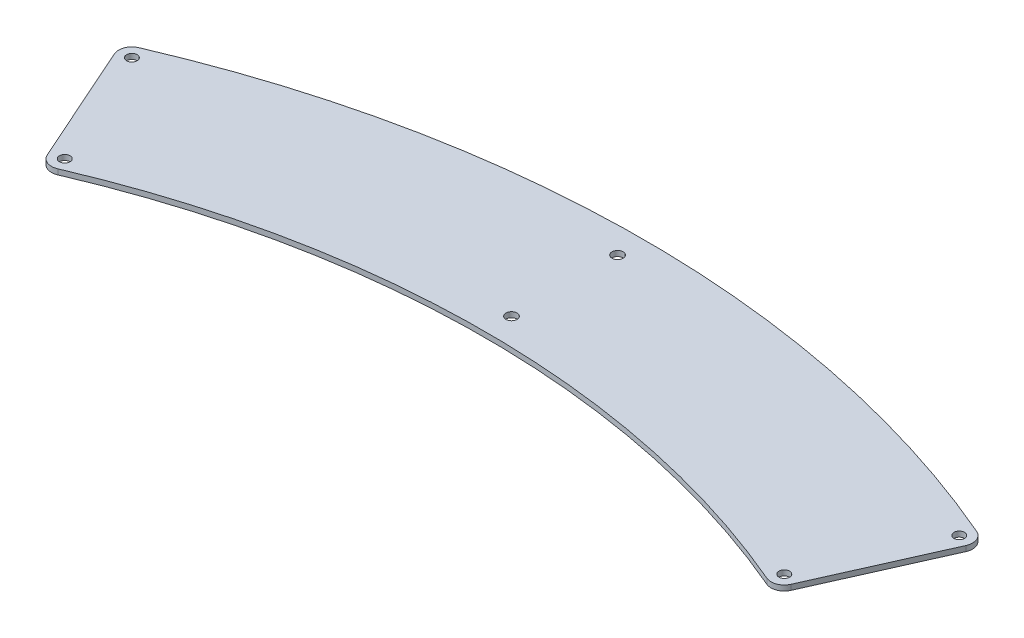
from build123d import *

# Parameters (mm, degrees)
SM_BASE_FLANGE_1_DEPTH = 2
FILLET_1_R             = 5
SKETCH_2_R             = 2.1
CUT_EXTRUDE_1_DEPTH    = 10
SKETCH_3_R             = 2
CUT_EXTRUDE_2_DEPTH    = 10


# Sheet-metal steps are written as plain solids
with BuildPart() as part:
    # Sketch 1 → Базовая кромка1 (new body)
    with BuildSketch(Plane(origin=(0, 0, 0), x_dir=(1, 0, 0), z_dir=(0, 1, 0))):
        with BuildLine():
            Line((-138.290458646, 310.605455598), (-162.69465723, 365.418183057))
            ThreePointArc((-162.69465723, 365.418183057), (0, 400), (162.69465723, 365.418183057))
            Line((162.69465723, 365.418183057), (138.290458646, 310.605455598))
            ThreePointArc((138.290458646, 310.605455598), (0, 340), (-138.290458646, 310.605455598))
        make_face()
    extrude(amount=-SM_BASE_FLANGE_1_DEPTH)

    # Скругление1
    fillet_1_edges = [part.edges().sort_by_distance(p)[0] for p in [
        (-138.290458646, -1, -310.605455598),
        (-162.69465723, -1, -365.418183057),
        (162.69465723, -1, -365.418183057),
        (138.290458646, -1, -310.605455598),
    ]]
    fillet(fillet_1_edges, radius=FILLET_1_R)

    # Эскиз2 → Вырез-Вытянуть1 (cut)
    with BuildSketch(Plane(origin=(0, 0, 0), x_dir=(1, 0, 0), z_dir=(0, 1, 0))):
        with Locations(Location((0, 350, 0), (0, 0, 270))):
            Circle(SKETCH_2_R)
        with Locations(Location((0, 390, 0), (0, 0, 270))):
            Circle(SKETCH_2_R)
    extrude(amount=-CUT_EXTRUDE_1_DEPTH, mode=Mode.SUBTRACT)

    # Эскиз3 → Вырез-Вытянуть2 (cut)
    with BuildSketch(Plane(origin=(0, 0, 0), x_dir=(1, 0, 0), z_dir=(0, 1, 0))):
        with Locations(Location((-135.741676964, 317.173764891, 0), (0, 0, 270))):
            Circle(SKETCH_3_R)
        with Locations(Location((-156.080374798, 362.85522816, 0), (0, 0, 270))):
            Circle(SKETCH_3_R)
        with Locations(Location((135.741676964, 317.173764891, 0), (0, 0, 270))):
            Circle(SKETCH_3_R)
        with Locations(Location((156.080374798, 362.85522816, 0), (0, 0, 270))):
            Circle(SKETCH_3_R)
    extrude(amount=-CUT_EXTRUDE_2_DEPTH, mode=Mode.SUBTRACT)


solid = part.part
